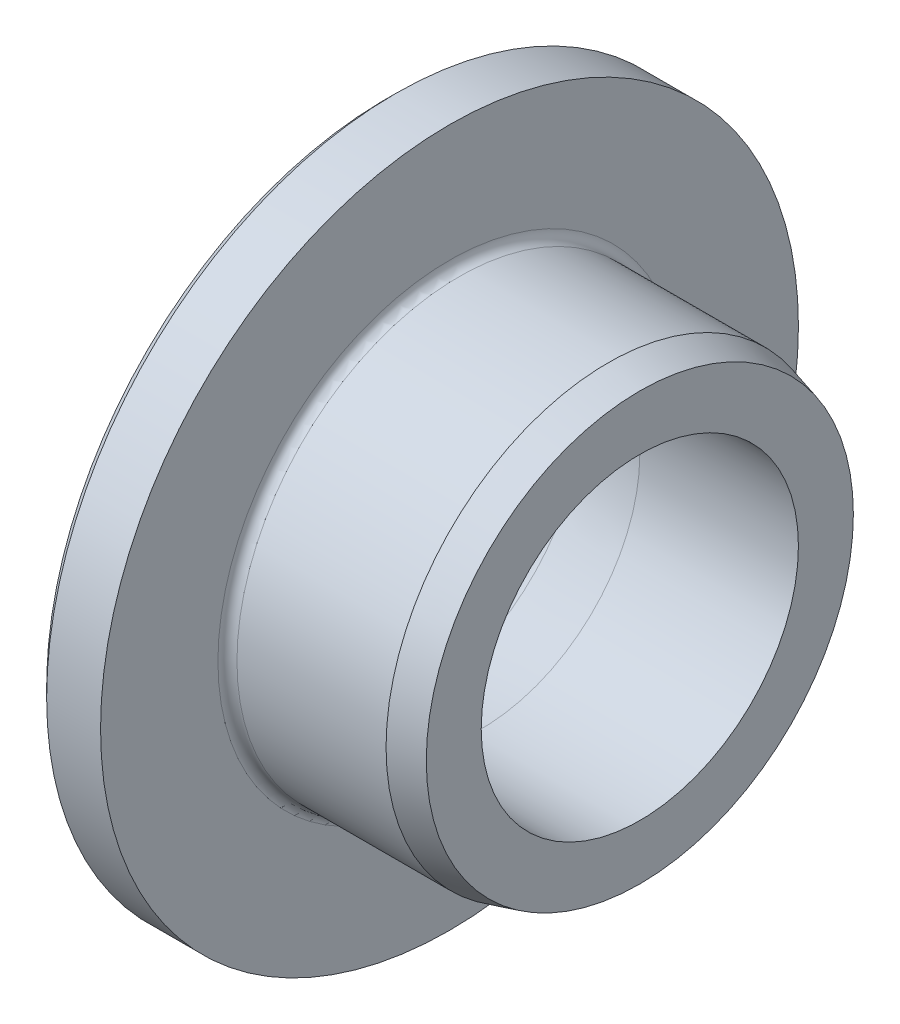
from build123d import *

# Parameters (mm, degrees)
CHAMFER1_SIZE  = 0.3
FILLET1_R      = 0.3
CHAMFER2_SIZE  = 3
CHAMFER2_SIZE2 = 0.528980942
CHAMFER3_SIZE  = 1
CHAMFER3_SIZE2 = 0.267949192
FILLET2_R      = 1


with BuildPart() as part:
    # Sketch1 → Revolve1 (revolve)
    with BuildSketch(Plane.XY):
        Polygon((-2, 5), (6, 5), (6, 7), (0, 7), (0, 11), (-2, 11), align=None)
    revolve(axis=Axis((-2, 0, 0), (1, 0, 0)))

    # Chamfer1
    chamfer1_edges = [part.edges().sort_by_distance(p)[0] for p in [
        (-2, -11, 0),
    ]]
    chamfer(chamfer1_edges, length=CHAMFER1_SIZE)

    # Fillet1
    fillet1_edges = [part.edges().sort_by_distance(p)[0] for p in [
        (0, -7, 0),
    ]]
    fillet(fillet1_edges, radius=FILLET1_R)

    # Chamfer2
    chamfer2_edges = [part.edges().sort_by_distance(p)[0] for p in [
        (-2, -5, 0),
    ]]
    chamfer2_side = [part.faces().sort_by_distance(p)[0] for p in [
        (2, -5, 0),
    ]]
    chamfer(chamfer2_edges, length=CHAMFER2_SIZE, length2=CHAMFER2_SIZE2, reference=chamfer2_side[0])

    # Chamfer3
    chamfer3_edges = [part.edges().sort_by_distance(p)[0] for p in [
        (6, -7, 0),
    ]]
    chamfer3_side = [part.faces().sort_by_distance(p)[0] for p in [
        (3.15, -7, 0),
    ]]
    chamfer(chamfer3_edges, length=CHAMFER3_SIZE, length2=CHAMFER3_SIZE2, reference=chamfer3_side[0])

    # Fillet2
    fillet2_edges = [part.edges().sort_by_distance(p)[0] for p in [
        (-2, -5.528980942, 0),
    ]]
    fillet(fillet2_edges, radius=FILLET2_R)


solid = part.part
